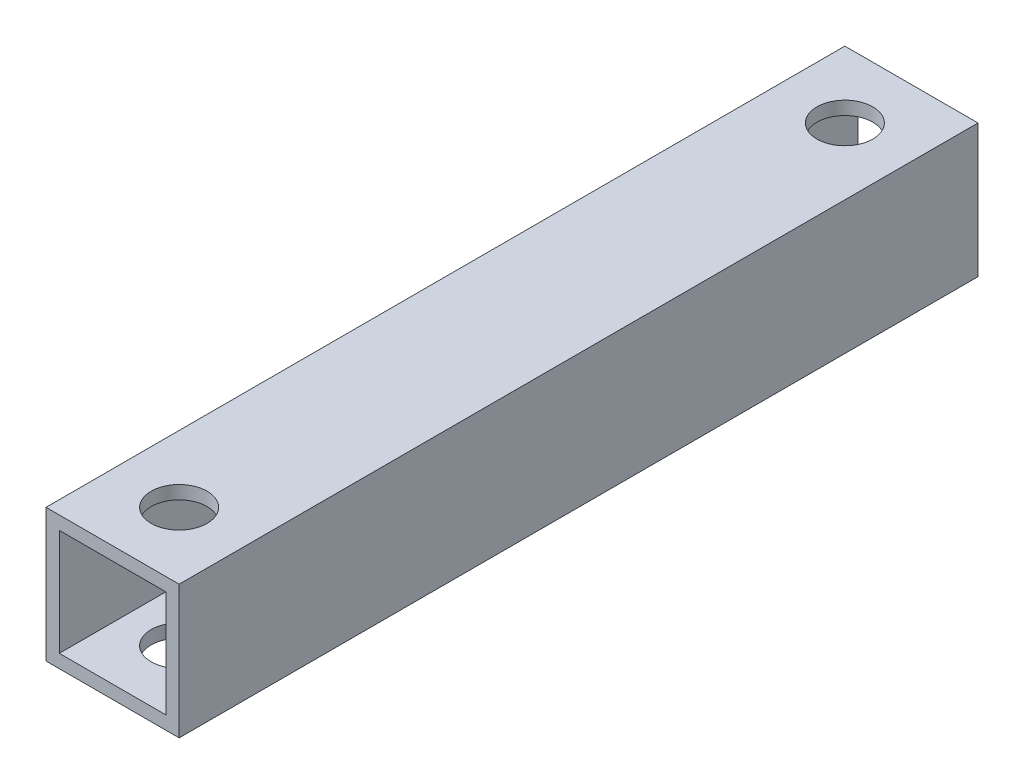
from build123d import *

# Parameters (mm, degrees)
SKETCH_1_W          = 10
SKETCH_1_H          = 10
SKETCH_1_W_2        = 8
SKETCH_1_H_2        = 8
EXTRUDE_1_DEPTH     = 60
SKETCH_2_R          = 2.1
CUT_EXTRUDE_1_DEPTH = 40


with BuildPart() as part:
    # ｽｹｯﾁ1 → ﾎﾞｽ - 押し出し1 (new body)
    with BuildSketch(Plane.XY):
        Rectangle(SKETCH_1_W, SKETCH_1_H)
        Rectangle(SKETCH_1_W_2, SKETCH_1_H_2, mode=Mode.SUBTRACT)
    extrude(amount=EXTRUDE_1_DEPTH)

    # ｽｹｯﾁ2 → ｶｯﾄ - 押し出し1 (cut)
    with BuildSketch(Plane(origin=(0, 5, 0), x_dir=(1, 0, 0), z_dir=(0, 1, 0))):
        with Locations((0, -5)):
            Circle(SKETCH_2_R)
        with Locations((0, -55)):
            Circle(SKETCH_2_R)
    extrude(amount=-CUT_EXTRUDE_1_DEPTH, mode=Mode.SUBTRACT)


solid = part.part
